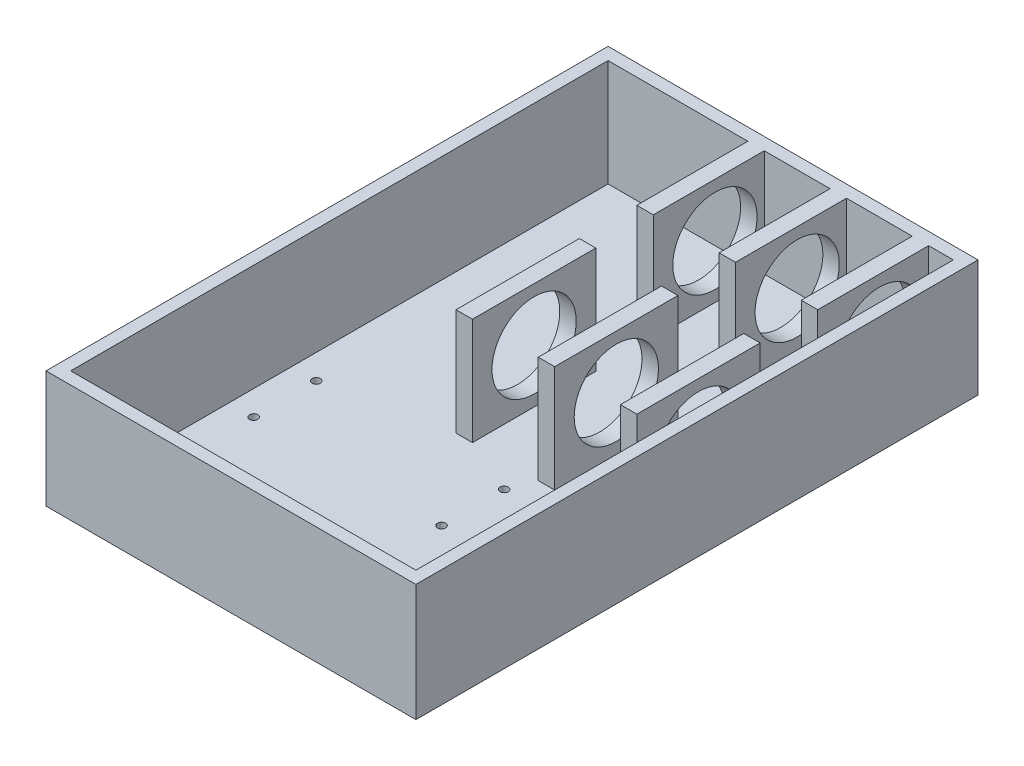
from build123d import *

# Parameters (mm, degrees)
SKETCH3_W           = 90
SKETCH3_H           = 136.761182254
BOSS_EXTRUDE2_DEPTH = 2.5
SKETCH4_W           = 4
SKETCH4_H           = 30
BOSS_EXTRUDE3_DEPTH = 26
SKETCH5_R           = 10.25
CUT_EXTRUDE1_DEPTH  = 150.415096196
SKETCH6_R           = 10.25
CUT_EXTRUDE2_DEPTH  = 150.415096196
SKETCH7_W           = 16
SKETCH7_H           = 3
BOSS_EXTRUDE5_DEPTH = 26
SKETCH8_R           = 1
CUT_EXTRUDE3_DEPTH  = 166.769783047


with BuildPart() as part:
    # Sketch3 → Boss-Extrude2 (new body)
    with BuildSketch(Plane(origin=(0, 0, 0), x_dir=(1, 0, 0), z_dir=(0, 1, 0))):
        with Locations((-45, -68.380591127)):
            Rectangle(SKETCH3_W, SKETCH3_H)
    extrude(amount=BOSS_EXTRUDE2_DEPTH)

    # Sketch4 → Boss-Extrude3 (add)
    with BuildSketch(Plane(origin=(0, 2.5, 0), x_dir=(1, 0, 0), z_dir=(0, 1, 0))):
        with Locations((-31, -15)):
            Rectangle(SKETCH4_W, SKETCH4_H)
        with Locations((-51, -15)):
            Rectangle(SKETCH4_W, SKETCH4_H)
        with Locations((-11, -15)):
            Rectangle(SKETCH4_W, SKETCH4_H)
        with Locations((-31, -59)):
            Rectangle(SKETCH4_W, SKETCH4_H)
        with Locations((-51, -59)):
            Rectangle(SKETCH4_W, SKETCH4_H)
        with Locations((-11, -59)):
            Rectangle(SKETCH4_W, SKETCH4_H)
    extrude(amount=BOSS_EXTRUDE3_DEPTH)

    # Sketch5 → Cut-Extrude1 (cut, through all)
    with BuildSketch(Plane.ZY.offset(53)):
        with Locations((15, 15.5)):
            Circle(SKETCH5_R)
    extrude(amount=-CUT_EXTRUDE1_DEPTH, mode=Mode.SUBTRACT)

    # Sketch6 → Cut-Extrude2 (cut, through all)
    with BuildSketch(Plane.ZY.offset(53)):
        with Locations((59, 15.5)):
            Circle(SKETCH6_R)
    extrude(amount=-CUT_EXTRUDE2_DEPTH, mode=Mode.SUBTRACT)

    # Sketch7 → Boss-Extrude5 (add)
    with BuildSketch(Plane(origin=(0, 2.5, 0), x_dir=(1, 0, 0), z_dir=(0, 1, 0))):
        Polygon((-9, -3), (-3, -3), (-3, -133.761182254), (-87, -133.761182254), (-87, -3), (-53, -3), (-53, 0), (-90, 0), (-90, -136.761182254), (0, -136.761182254), (0, 0), (-9, 0), align=None)
        with Locations((-21, -1.5)):
            Rectangle(SKETCH7_W, SKETCH7_H)
        with Locations((-41, -1.5)):
            Rectangle(SKETCH7_W, SKETCH7_H)
    extrude(amount=BOSS_EXTRUDE5_DEPTH)

    # Sketch8 → Cut-Extrude3 (cut, through all)
    with BuildSketch(Plane(origin=(0, 2.5, 0), x_dir=(1, 0, 0), z_dir=(0, 1, 0))):
        with Locations((-81, -80)):
            Circle(SKETCH8_R)
        with Locations((-35.28, -80)):
            Circle(SKETCH8_R)
        with Locations((-35.28, -95.24)):
            Circle(SKETCH8_R)
        with Locations((-81, -95.24)):
            Circle(SKETCH8_R)
    extrude(amount=-CUT_EXTRUDE3_DEPTH, mode=Mode.SUBTRACT)


solid = part.part
